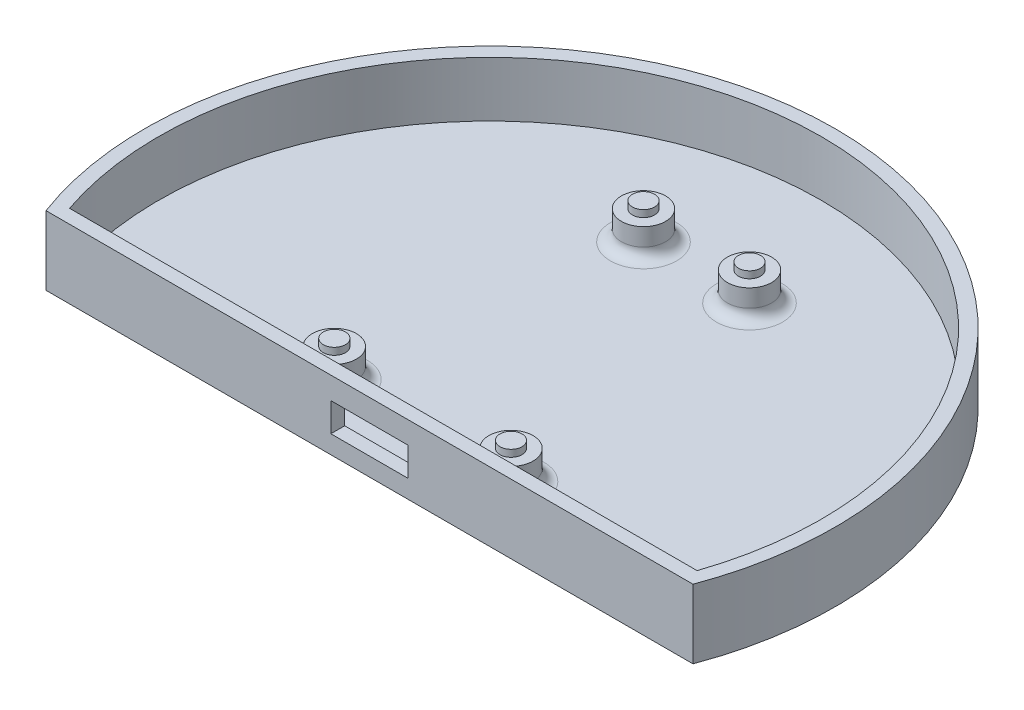
from build123d import *

# Parameters (mm, degrees)
BOSS_EXTRUDE1_DEPTH = 1.5875
BOSS_EXTRUDE2_DEPTH = 6.35
SKETCH5_R           = 2.54
BOSS_EXTRUDE3_DEPTH = 3.302
SKETCH6_R           = 1.27
BOSS_EXTRUDE4_DEPTH = 0.8
FILLET1_R           = 1.27
SKETCH8_W           = 8.89
SKETCH8_H           = 3.302
CUT_EXTRUDE2_DEPTH  = 1.5875


with BuildPart() as part:
    # Sketch1 → Boss-Extrude1 (new body)
    with BuildSketch(Plane(origin=(0, 0, 0), x_dir=(1, 0, 0), z_dir=(0, 1, 0))):
        with BuildLine():
            ThreePointArc((37.210185776, -20.338206619), (0, 33.21931907), (-37.210185776, -20.338206619))
            Line((-37.210185776, -20.338206619), (37.210185776, -20.338206619))
        make_face()
    extrude(amount=BOSS_EXTRUDE1_DEPTH)

    # Sketch2 → Boss-Extrude2 (add)
    with BuildSketch(Plane(origin=(0, 1.5875, 0), x_dir=(1, 0, 0), z_dir=(0, 1, 0))):
        with BuildLine():
            ThreePointArc((37.210185776, -20.338206619), (0, 33.21931907), (-37.210185776, -20.338206619))
            Line((-37.210185776, -20.338206619), (37.210185776, -20.338206619))
        make_face()
        with BuildLine():
            Line((36.090388192, -18.750706619), (-36.090388192, -18.750706619))
            ThreePointArc((-36.090388192, -18.750706619), (0, 31.63181907), (36.090388192, -18.750706619))
        make_face(mode=Mode.SUBTRACT)
    extrude(amount=BOSS_EXTRUDE2_DEPTH)

    # Sketch5 → Boss-Extrude3 (add)
    with BuildSketch(Plane(origin=(0, 1.5875, 0), x_dir=(1, 0, 0), z_dir=(0, 1, 0))):
        with Locations((-6.096, 17.272)):
            Circle(SKETCH5_R)
        with Locations((6.096, 17.272)):
            Circle(SKETCH5_R)
        with Locations((10.16, -14.224)):
            Circle(SKETCH5_R)
        with Locations((-10.16, -14.224)):
            Circle(SKETCH5_R)
    extrude(amount=BOSS_EXTRUDE3_DEPTH)

    # Sketch6 → Boss-Extrude4 (add)
    with BuildSketch(Plane(origin=(0, 4.8895, 0), x_dir=(1, 0, 0), z_dir=(0, 1, 0))):
        with Locations((-6.096, 17.272)):
            Circle(SKETCH6_R)
        with Locations((6.096, 17.272)):
            Circle(SKETCH6_R)
        with Locations((10.16, -14.224)):
            Circle(SKETCH6_R)
        with Locations((-10.16, -14.224)):
            Circle(SKETCH6_R)
    extrude(amount=BOSS_EXTRUDE4_DEPTH)

    # Fillet1
    fillet1_edges = [part.edges().sort_by_distance(p)[0] for p in [
        (-12.7, 1.5875, 14.224),
        (7.62, 1.5875, 14.224),
        (3.556, 1.5875, -17.272),
        (-8.636, 1.5875, -17.272),
    ]]
    fillet(fillet1_edges, radius=FILLET1_R)

    # Sketch8 → Cut-Extrude2 (cut)
    with BuildSketch(Plane.XY.offset(20.338206619)):
        with Locations((0, 3.7465)):
            Rectangle(SKETCH8_W, SKETCH8_H)
    extrude(amount=-CUT_EXTRUDE2_DEPTH, mode=Mode.SUBTRACT)


solid = part.part
